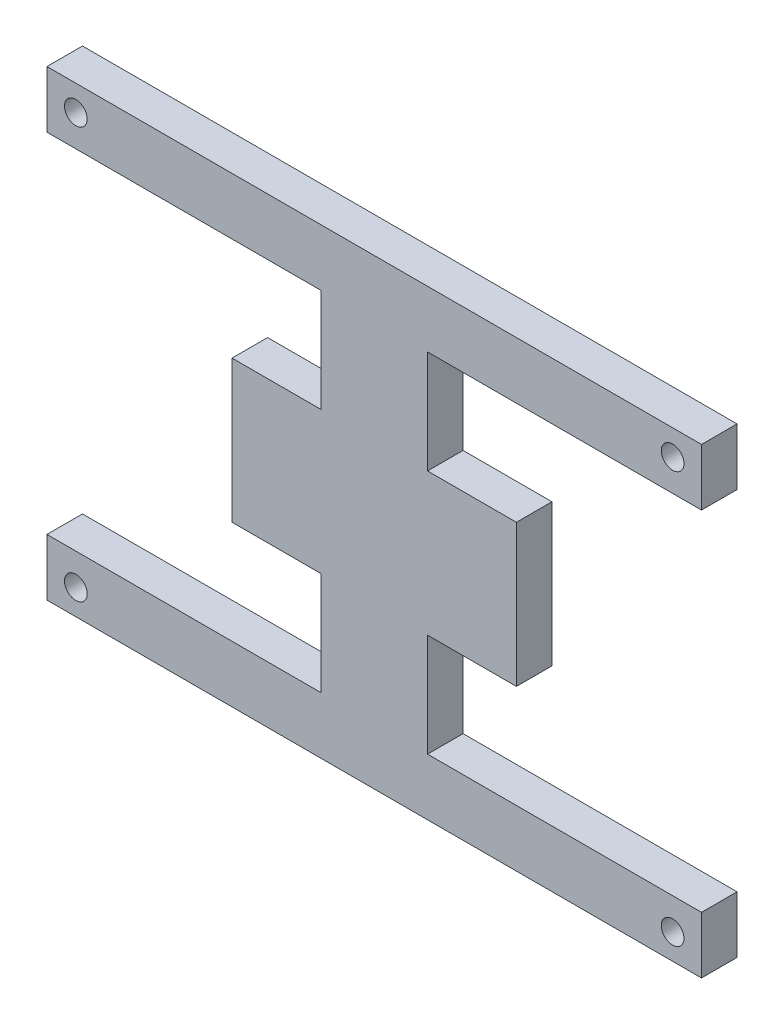
from build123d import *

# Parameters (mm, degrees)
SKETCH_1_R      = 1.6
EXTRUDE_1_DEPTH = 5


with BuildPart() as part:
    # 草图1 → 凸台-拉伸1 (new body)
    with BuildSketch(Plane.XY):
        Polygon((46.0375, 32.5), (-46.0375, 32.5), (-46.0375, 24.5), (-7.5, 24.5), (-7.5, 10), (-20, 10), (-20, -10), (-7.5, -10), (-7.5, -24.5), (-46.0375, -24.5), (-46.0375, -32.5), (46.0375, -32.5), (46.0375, -24.5), (7.5, -24.5), (7.5, -10), (20, -10), (20, 10), (7.5, 10), (7.5, 24.5), (46.0375, 24.5), align=None)
        with Locations((-41.9735, 28.92)):
            Circle(SKETCH_1_R, mode=Mode.SUBTRACT)
        with Locations((41.9735, 28.92)):
            Circle(SKETCH_1_R, mode=Mode.SUBTRACT)
        with Locations((41.9735, -28.92)):
            Circle(SKETCH_1_R, mode=Mode.SUBTRACT)
        with Locations((-41.9735, -28.92)):
            Circle(SKETCH_1_R, mode=Mode.SUBTRACT)
    extrude(amount=EXTRUDE_1_DEPTH)


solid = part.part
